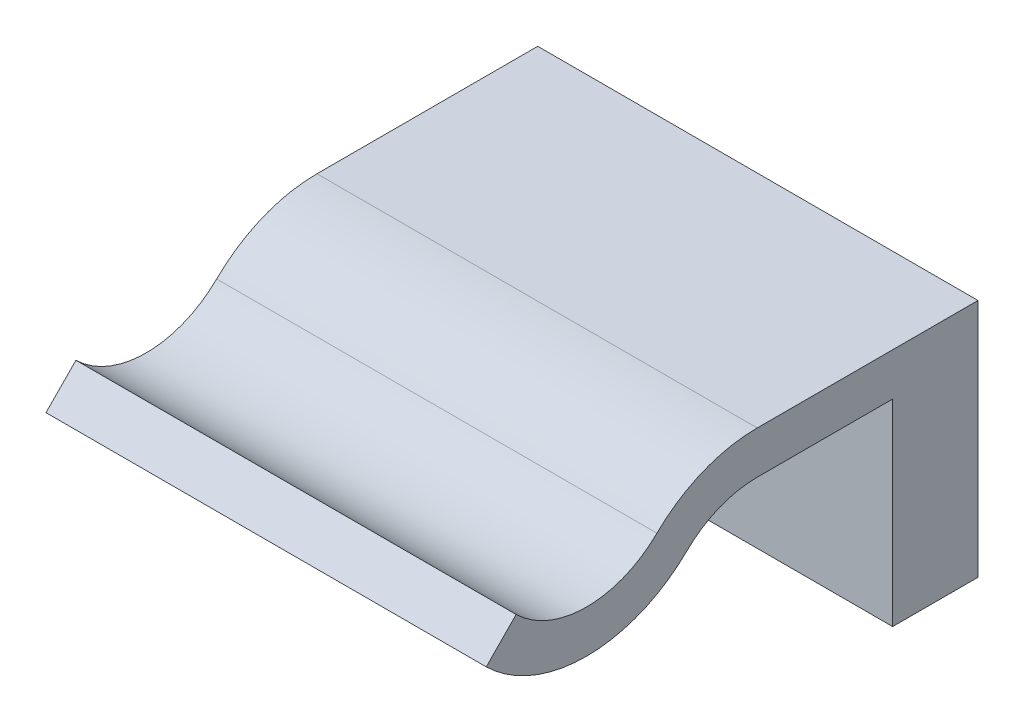
from build123d import *

# Parameters (mm, degrees)
BOSS_EXTRUDE1_DEPTH            = 1.6
QQ_DEPTH                       = 7.62
BOSS_EXTRUDE3_DEPTH            = 4.1275
BOSS_EXTRUDE3_DEPTH_BACK       = 4.1275
CUT_EXTRUDE1_REACH             = 16.256
CUT_EXTRUDE1_DIRECTION_2_DEPTH = 0.508
SURFACECUT1_START              = -3.7338
SURFACECUT1_DEPTH              = 4.1656
SURFACECUT1_START_2            = 0.4318
SURFACECUT1_2_DEPTH            = 2.362
SURFACECUT1_3_OUTLINE_W        = 8.255
SURFACECUT1_3_OUTLINE_H        = 1.6
SURFACECUT1_3_DEPTH            = 2.032


# Read off the part's stored shape, not the designer's step: SurfaceCut1
with BuildPart() as part:
    # Sketch1 → Boss-Extrude1 (new body)
    with BuildSketch(Plane.XY):
        Polygon((-5.7275, -2.7938), (-5.7275, 2.7938), (5.7275, 2.7938), (5.7275, -2.7938), (5.7275, -3.7338), (-5.7275, -3.7338), align=None)
    extrude(amount=-BOSS_EXTRUDE1_DEPTH)

    # Sketch2 → qq (add)
    with BuildSketch(Plane.XY):
        Polygon((-4.6355, 1.7018), (-4.6355, 2.7938), (-5.7275, 2.7938), (-5.7275, -3.7338), (5.7275, -3.7338), (5.7275, 2.7938), (4.6355, 2.7938), (4.6355, 1.7018), (4.6355, -1.7018), (-4.6355, -1.7018), align=None)
    extrude(amount=QQ_DEPTH)

    # Sketch3 → Boss-Extrude3 (add, two sides: drawn at the far end of the back side and taken through both)
    with BuildSketch(Plane(origin=(0, 0, 0), x_dir=(0, 0, -1), z_dir=(1, 0, 0)).offset(-BOSS_EXTRUDE3_DEPTH_BACK)):
        with BuildLine():
            Line((0, 2.7938), (0, 1.9938))
            Line((0, 1.9938), (-2.54, 1.9938))
            ThreePointArc((-2.54, 1.9938), (-3.252870113, 1.853726552), (-3.859739447, 1.454334539))
            ThreePointArc((-3.859739447, 1.454334539), (-5.739869724, 0.6858), (-7.62, 1.454334539))
            Line((-7.62, 1.454334539), (-7.059609171, 2.025265461))
            ThreePointArc((-7.059609171, 2.025265461), (-5.739869724, 1.4858), (-4.420130276, 2.025265461))
            ThreePointArc((-4.420130276, 2.025265461), (-3.555570676, 2.594248239), (-2.54, 2.7938))
            Line((-2.54, 2.7938), (0, 2.7938))
        make_face()
    extrude(amount=BOSS_EXTRUDE3_DEPTH + BOSS_EXTRUDE3_DEPTH_BACK)

    # Sketch4 → Cut-Extrude1 (cut, up to next)
    with BuildSketch(Plane.ZY.offset(5.7275), mode=Mode.PRIVATE) as cut_extrude1_sk1:
        with BuildLine():
            Line((7.62, 0.6858), (7.62, 2.7938))
            Line((7.62, 2.7938), (0, 2.7938))
            Line((0, 2.7938), (0, 1.9938))
            Line((0, 1.9938), (0, 1.7398))
            Line((0, 1.7398), (2.54, 1.7398))
            ThreePointArc((2.54, 1.7398), (3.156762684, 1.618610916), (3.681815359, 1.273063971))
            ThreePointArc((3.681815359, 1.273063971), (4.628191619, 0.650236125), (5.739869724, 0.4318))
            Line((5.739869724, 0.4318), (7.62, 0.4318))
            Line((7.62, 0.4318), (7.62, 0.6858))
        make_face()
    cut_extrude1_tool1 = extrude(cut_extrude1_sk1.sketch, amount=-CUT_EXTRUDE1_REACH, mode=Mode.PRIVATE) & part.part
    cut_extrude1 = cut_extrude1_tool1.solids().sort_by_distance((-5.7275, 1.850249, 4.529461))[0]
    add(cut_extrude1, mode=Mode.SUBTRACT)

    # Sketch4 → Cut-Extrude1 direction 2 (cut)
    with BuildSketch(Plane.ZY.offset(5.7275)):
        with BuildLine():
            Line((7.62, 0.6858), (7.62, 2.7938))
            Line((7.62, 2.7938), (0, 2.7938))
            Line((0, 2.7938), (0, 1.9938))
            Line((0, 1.9938), (0, 1.7398))
            Line((0, 1.7398), (2.54, 1.7398))
            ThreePointArc((2.54, 1.7398), (3.156762684, 1.618610916), (3.681815359, 1.273063971))
            ThreePointArc((3.681815359, 1.273063971), (4.628191619, 0.650236125), (5.739869724, 0.4318))
            Line((5.739869724, 0.4318), (7.62, 0.4318))
            Line((7.62, 0.4318), (7.62, 0.6858))
        make_face()
    cut_extrude1_direction_2 = extrude(amount=CUT_EXTRUDE1_DIRECTION_2_DEPTH, mode=Mode.SUBTRACT)

    # Mirror1: Cut-Extrude1, Cut-Extrude1 direction 2 across plane
    add(cut_extrude1.mirror(Plane(origin=(0, 0, 0), x_dir=(0, 0, 1), z_dir=(1, 0, 0))), mode=Mode.SUBTRACT)
    add(cut_extrude1_direction_2.mirror(Plane(origin=(0, 0, 0), x_dir=(0, 0, 1), z_dir=(1, 0, 0))), mode=Mode.SUBTRACT)

    # SurfaceCut1 outline → SurfaceCut1 (cut)
    with BuildSketch(Plane(origin=(0, 0, 0), x_dir=(1, 0, 0), z_dir=(0, 1, 0)).offset(SURFACECUT1_START)):
        Polygon((-4.1275, 0), (-4.1275, 1.6), (-5.7275, 1.6), (-5.7275, -7.62), (5.7275, -7.62), (5.7275, 1.6), (4.1275, 1.6), (4.1275, 0), align=None)
    extrude(amount=SURFACECUT1_DEPTH, mode=Mode.SUBTRACT)

    # SurfaceCut1 2 outline → SurfaceCut1 2 (cut)
    with BuildSketch(Plane(origin=(0, 0, 0), x_dir=(1, 0, 0), z_dir=(0, 1, 0)).offset(SURFACECUT1_START_2)):
        Polygon((-4.1275, 0), (-4.1275, 1.6), (-5.7275, 1.6), (-5.7275, -7.62), (-4.6355, -7.62), (-4.6355, 0), align=None)
        Polygon((5.7275, 1.6), (4.1275, 1.6), (4.1275, 0), (4.6355, 0), (4.6355, -7.62), (5.7275, -7.62), align=None)
    extrude(amount=SURFACECUT1_2_DEPTH, mode=Mode.SUBTRACT)

    # SurfaceCut1 3 outline → SurfaceCut1 3 (cut)
    with BuildSketch(Plane(origin=(0, 0, 0), x_dir=(1, 0, 0), z_dir=(0, 1, 0)).offset(SURFACECUT1_START)):
        with Locations((0, 0.8)):
            Rectangle(SURFACECUT1_3_OUTLINE_W, SURFACECUT1_3_OUTLINE_H)
    extrude(amount=SURFACECUT1_3_DEPTH, mode=Mode.SUBTRACT)


solid = part.part
